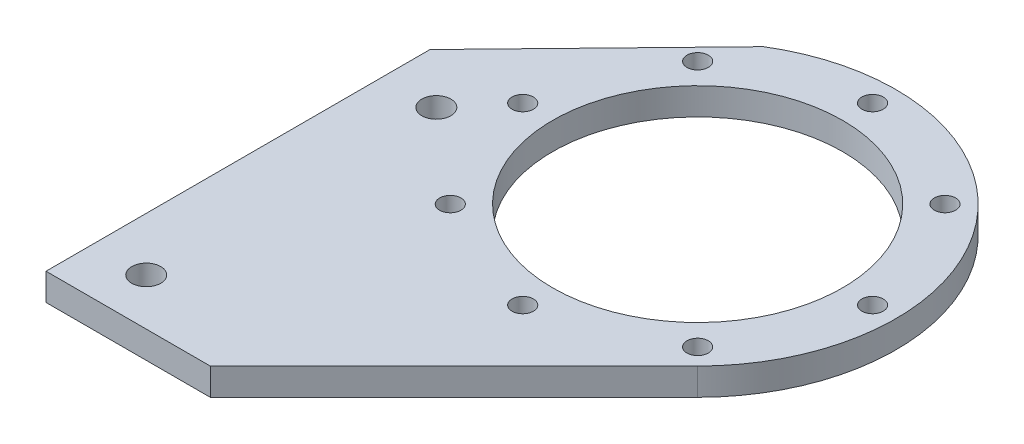
from build123d import *

# Parameters (mm, degrees)
BASE_FLANGE1_DEPTH = 6.35
SKETCH8_R          = 3.4
CUT_EXTRUDE1_DEPTH = 175.95180765
SKETCH9_R          = 34
CUT_EXTRUDE2_DEPTH = 175.95180765
SKETCH10_R         = 2.5
CUT_EXTRUDE3_DEPTH = 175.95180765


# Sheet-metal steps are written as plain solids
with BuildPart() as part:
    # Sketch2 → Base-Flange1 (new body)
    with BuildSketch(Plane(origin=(0, 0, 0), x_dir=(1, 0, 0), z_dir=(0, 1, 0))):
        with BuildLine():
            Line((0, 0), (38.51093065, 0))
            Line((38.51093065, 0), (95.630465325, 57.119534675))
            ThreePointArc((95.630465325, 57.119534675), (99.287953618, 118.761570635), (38.51093065, 129.682710556))
            Line((38.51093065, 129.682710556), (0, 90))
            Line((0, 90), (0, 0))
        make_face()
    extrude(amount=-BASE_FLANGE1_DEPTH)

    # Sketch8 → Cut-Extrude1 (cut, through all)
    with BuildSketch(Plane(origin=(0, 0, 0), x_dir=(1, 0, 0), z_dir=(0, 1, 0))):
        with Locations(Location((12.5, 79, 0), (0, 0, 270))):
            Circle(SKETCH8_R)
        with Locations(Location((12.5, 11, 0), (0, 0, 90))):
            Circle(SKETCH8_R)
    extrude(amount=-CUT_EXTRUDE1_DEPTH, mode=Mode.SUBTRACT)

    # Sketch9 → Cut-Extrude2 (cut, through all)
    with BuildSketch(Plane(origin=(0, 0, 0), x_dir=(1, 0, 0), z_dir=(0, 1, 0))):
        with Locations(Location((62.75, 90, 0), (0, 0, 270))):
            Circle(SKETCH9_R)
    extrude(amount=-CUT_EXTRUDE2_DEPTH, mode=Mode.SUBTRACT)

    # Sketch10 → Cut-Extrude3 (cut, through all)
    with BuildSketch(Plane(origin=(0, 0, 0), x_dir=(1, 0, 0), z_dir=(0, 1, 0))):
        with Locations(Location((62.75, 131, 0), (0, 0, 270))):
            Circle(SKETCH10_R)
        with Locations(Location((91.741378029, 118.991378029, 0), (0, 0, 270))):
            Circle(SKETCH10_R)
        with Locations(Location((103.75, 90, 0), (0, 0, 270))):
            Circle(SKETCH10_R)
        with Locations(Location((91.741378029, 61.008621971, 0), (0, 0, 270))):
            Circle(SKETCH10_R)
        with Locations(Location((62.75, 49, 0), (0, 0, 270))):
            Circle(SKETCH10_R)
        with Locations(Location((33.758621971, 61.008621971, 0), (0, 0, 270))):
            Circle(SKETCH10_R)
        with Locations(Location((21.75, 90, 0), (0, 0, 270))):
            Circle(SKETCH10_R)
        with Locations(Location((33.758621971, 118.991378029, 0), (0, 0, 270))):
            Circle(SKETCH10_R)
    extrude(amount=-CUT_EXTRUDE3_DEPTH, mode=Mode.SUBTRACT)


solid = part.part
